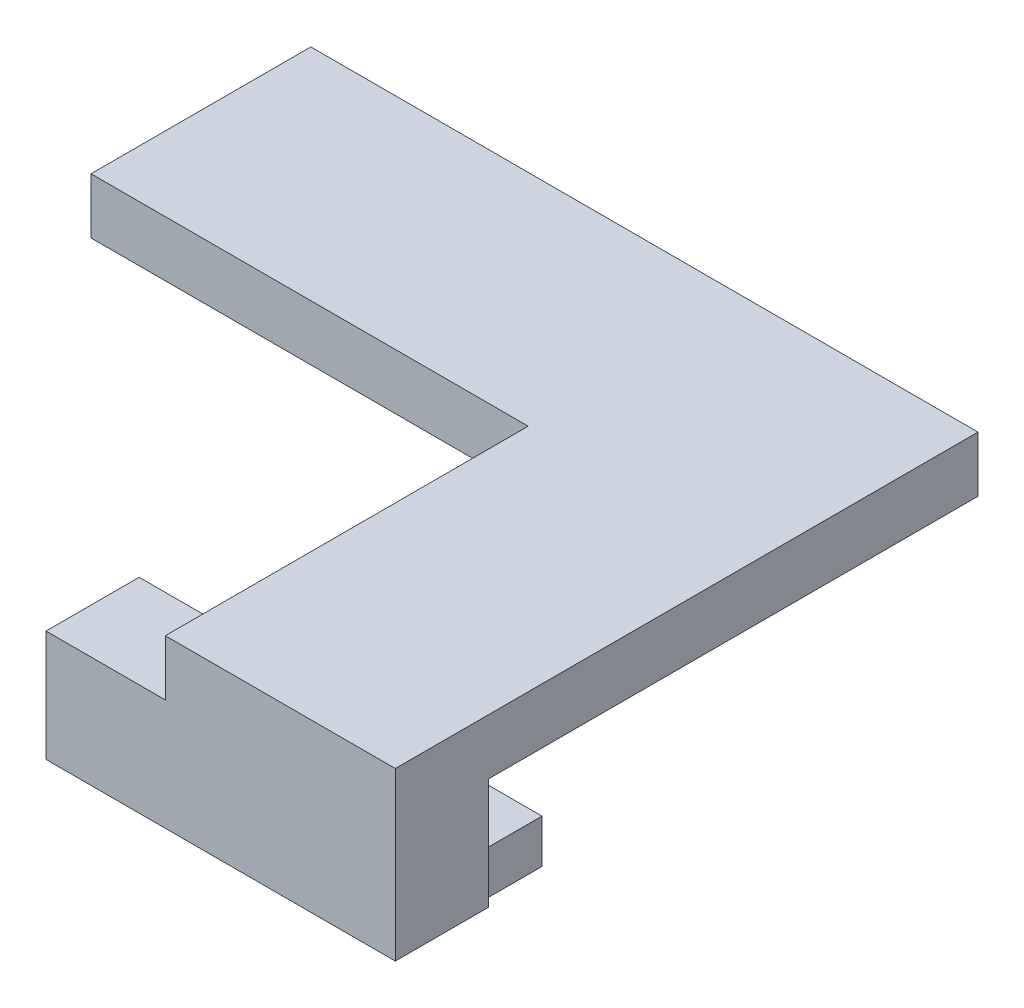
from build123d import *

# Parameters (mm, degrees)
BOSS_EXTRUDE1_DEPTH = 6.35
SKETCH5_W           = 39.894724698
SKETCH5_H           = 10.639167107
BOSS_EXTRUDE5_DEPTH = 12.7
SKETCH6_W           = 12.7
SKETCH6_H           = 4.985682945
SKETCH6_W_2         = 12.46553989
BOSS_EXTRUDE6_DEPTH = 6.35


with BuildPart() as part:
    # Sketch1 → Boss-Extrude1 (new body)
    with BuildSketch(Plane(origin=(0, 0, 0), x_dir=(1, 0, 0), z_dir=(0, 1, 0))):
        Polygon((-60.276435376, 19.702951031), (15.923564624, 19.702951031), (15.923564624, -5.40006806), (15.923564624, -46.849239118), (-10.347036751, -46.849239118), (-10.347036751, -5.40006806), (-60.276435376, -5.40006806), align=None)
    extrude(amount=BOSS_EXTRUDE1_DEPTH)

    # Sketch5 → Boss-Extrude5 (add)
    with BuildSketch(Plane.XZ):
        with Locations((-4.023797725, 41.529655565)):
            Rectangle(SKETCH5_W, SKETCH5_H)
    extrude(amount=BOSS_EXTRUDE5_DEPTH)

    # Sketch6 → Boss-Extrude6 (add)
    with BuildSketch(Plane(origin=(0, 0, 36.210072011), x_dir=(-1, 0, 0), z_dir=(0, 0, -1))):
        with Locations((15.826435376, -9.463807858)):
            Rectangle(SKETCH6_W, SKETCH6_H)
        with Locations((-9.456334569, -9.463807858)):
            Rectangle(SKETCH6_W_2, SKETCH6_H)
    extrude(amount=BOSS_EXTRUDE6_DEPTH)


solid = part.part
